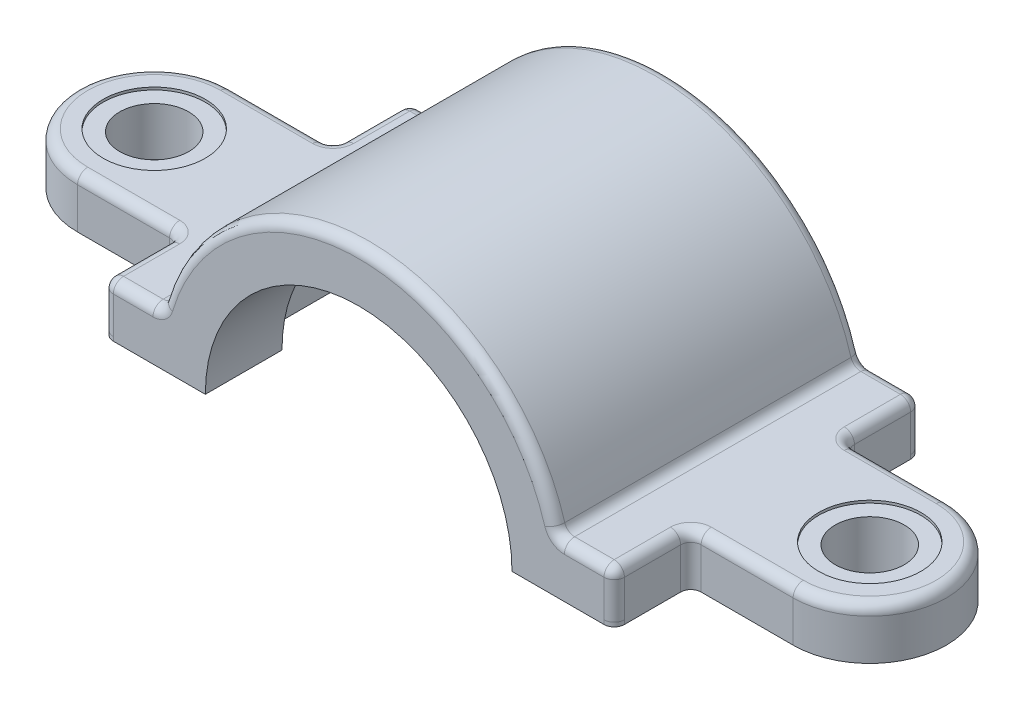
from build123d import *

# Parameters (mm, degrees)
EXTRUDE_1_DEPTH               = 45
EXTRUDE_2_DEPTH               = 10
SKETCH_3_W                    = 15
SKETCH_3_H                    = 10
CUT_EXTRUDE_1_DEPTH           = 20.000000002
EXTRUDE_3_DEPTH               = 15
CUT_EXTRUDE_2_DEPTH           = 0.8
CUT_EXTRUDE_3_DEPTH           = 0.8
CUT_EXTRUDE_4_DEPTH           = 0.8
CUT_EXTRUDE_5_DEPTH           = 0.8
SKETCH_9_W                    = 70.000000048
SKETCH_9_H                    = 30
CUT_EXTRUDE_6_DEPTH           = 15
HOLE_WIZARD_M52_1_D           = 60
HOLE_WIZARD_M12_1_D           = 13.5
HOLE_WIZARD_M12_1_CBORE_D     = 20
HOLE_WIZARD_M12_1_CBORE_DEPTH = 0.5
FILLET_1_R                    = 2


with BuildPart() as part:
    # 草图1 → 凸台-拉伸1 (new body)
    with BuildSketch(Plane.XY.offset(30)):
        with BuildLine():
            Line((-38.729833462, 10), (38.729833462, 10))
            ThreePointArc((38.729833462, 10), (0, 40), (-38.729833462, 10))
        make_face()
    extrude(amount=-EXTRUDE_1_DEPTH)

    # 草图2 → 凸台-拉伸2 (add)
    with BuildSketch(Plane.XZ.offset(-10)):
        with BuildLine():
            Line((-70, 15), (-50, 15))
            Line((-50, 15), (-50, 30))
            Line((-50, 30), (70, 30))
            Line((70, 30), (70, 15))
            ThreePointArc((70, 15), (85, 0), (70, -15))
            Line((70, -15), (-70, -15))
            ThreePointArc((-70, -15), (-85, 0), (-70, 15))
        make_face()
    extrude(amount=EXTRUDE_2_DEPTH)

    # 草图3 → 切除-拉伸1 (cut)
    with BuildSketch(Plane(origin=(70, 0, 0), x_dir=(0, 0, -1), z_dir=(1, 0, 0))):
        with Locations((-22.5, 5)):
            Rectangle(SKETCH_3_W, SKETCH_3_H)
    extrude(amount=-CUT_EXTRUDE_1_DEPTH, mode=Mode.SUBTRACT)

    # 草图4 → 凸台-拉伸3 (add)
    with BuildSketch(Plane(origin=(0, 0, -15), x_dir=(-1, 0, 0), z_dir=(0, 0, -1))):
        with BuildLine():
            Line((-50, 0), (-50, 10))
            Line((-50, 10), (-38.729833462, 10))
            ThreePointArc((-38.729833462, 10), (0, 40), (38.729833462, 10))
            Line((38.729833462, 10), (50, 10))
            Line((50, 10), (50, 0))
            Line((50, 0), (-50, 0))
        make_face()
    extrude(amount=EXTRUDE_3_DEPTH)

    # 草图5 → 切除-拉伸2 (cut)
    with BuildSketch(Plane.XZ):
        with BuildLine():
            Line((49.999999992, 28), (49.999999992, 29.999999996))
            Line((49.999999992, 29.999999996), (47.999999996, 29.999999996))
            ThreePointArc((47.999999996, 29.999999996), (49.414213556, 29.41421356), (49.999999992, 28))
        make_face()
    extrude(amount=-CUT_EXTRUDE_2_DEPTH, mode=Mode.SUBTRACT)

    # 草图6 → 切除-拉伸3 (cut)
    with BuildSketch(Plane.XZ):
        with BuildLine():
            Line((-48.000000004, 29.999999996), (-50, 29.999999996))
            Line((-50, 29.999999996), (-50, 28))
            ThreePointArc((-50, 28), (-49.414213564, 29.41421356), (-48.000000004, 29.999999996))
        make_face()
    extrude(amount=-CUT_EXTRUDE_3_DEPTH, mode=Mode.SUBTRACT)

    # 草图7 → 切除-拉伸4 (cut)
    with BuildSketch(Plane.XZ):
        with BuildLine():
            Line((48, -30), (49.999999996, -30))
            Line((49.999999996, -30), (49.999999996, -28.000000004))
            ThreePointArc((49.999999996, -28.000000004), (49.41421356, -29.414213564), (48, -30))
        make_face()
    extrude(amount=-CUT_EXTRUDE_4_DEPTH, mode=Mode.SUBTRACT)

    # 草图8 → 切除-拉伸5 (cut)
    with BuildSketch(Plane.XZ):
        with BuildLine():
            Line((-49.999999996, -28.000000004), (-49.999999996, -30))
            Line((-49.999999996, -30), (-48, -30))
            ThreePointArc((-48, -30), (-49.41421356, -29.414213564), (-49.999999996, -28.000000004))
        make_face()
    extrude(amount=-CUT_EXTRUDE_5_DEPTH, mode=Mode.SUBTRACT)

    # 草图9 → 切除-拉伸6 (cut)
    with BuildSketch(Plane.XZ):
        Rectangle(SKETCH_9_W, SKETCH_9_H)
    extrude(amount=-CUT_EXTRUDE_6_DEPTH, mode=Mode.SUBTRACT)

    # M52 间隙孔1 (through all)
    with Locations(Plane(origin=(0, 0, -30), x_dir=(-1, 0, 0), z_dir=(0, 0, -1))):
        with Locations((0, 0)):
            Hole(HOLE_WIZARD_M52_1_D / 2)

    # M12 六角头螺栓的柱形沉头孔1 (through all)
    with Locations(Plane(origin=(0, 10, 0), x_dir=(1, 0, 0), z_dir=(0, 1, 0))):
        with Locations((-70, 0), (70, 0)):
            CounterBoreHole(HOLE_WIZARD_M12_1_D / 2, HOLE_WIZARD_M12_1_CBORE_D / 2, HOLE_WIZARD_M12_1_CBORE_DEPTH)

    # 圆角1
    fillet_1_edges = [part.edges().sort_by_distance(p)[0] for p in [
        (-50, 5.4, 30),
        (-50, 10, 22.5),
        (-60, 10, 15),
        (-85, 10, 0),
        (-60, 10, -15),
        (-50, 10, -22.5),
        (-50, 5.4, -30),
        (-44.364916731, 10, 30),
        (38.729833462, 10, 0),
        (-38.729833462, 10, 0),
        (0, 40, 30),
        (44.36491673, 10, 30),
        (-44.364916731, 10, -30),
        (0, 40, -30),
        (44.364916731, 10, -30),
        (49.999999998, 5.4, 30),
        (50, 5.4, -30),
        (49.999999998, 10, 22.5),
        (59.999999999, 10, 15),
        (85, 10, 0),
        (50, 10, -22.5),
        (60, 10, -15),
        (50, 5, -15),
        (-50, 5, -15),
        (-50, 5, 15),
        (49.999999998, 5, 15),
    ]]
    fillet(fillet_1_edges, radius=FILLET_1_R - 0.0001)  # a hair under: the kernel refuses the full size


solid = part.part
